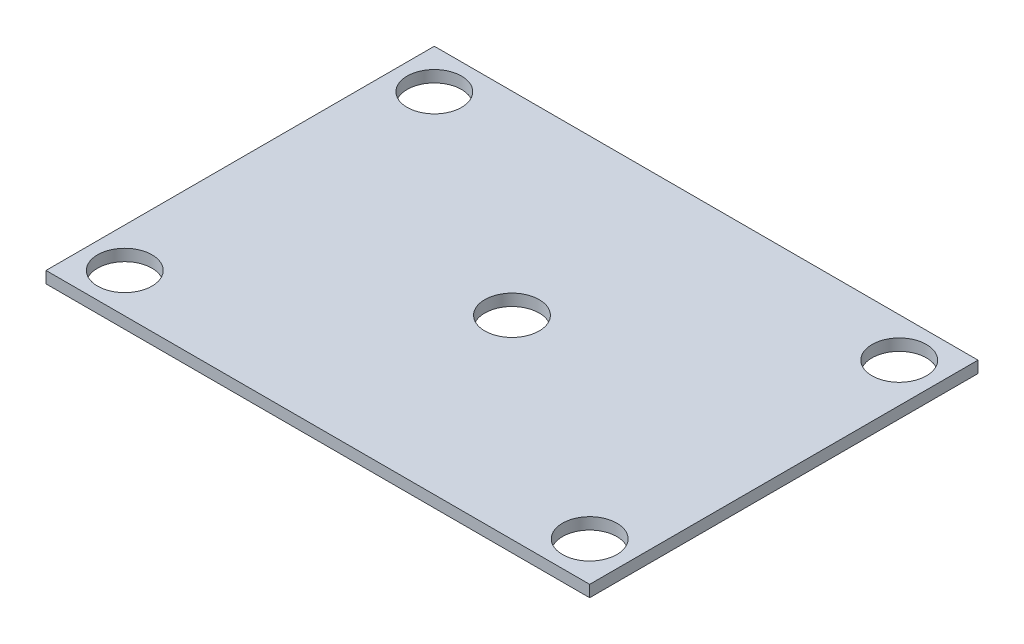
from build123d import *

# Parameters (mm, degrees)
SKETCH1_W           = 70
SKETCH1_H           = 50
BOSS_EXTRUDE1_DEPTH = 1.5
SKETCH2_R           = 3.5
CUT_EXTRUDE1_DEPTH  = 44.037774106


with BuildPart() as part:
    # Sketch1 → Boss-Extrude1 (new body)
    with BuildSketch(Plane(origin=(0, 0, 0), x_dir=(1, 0, 0), z_dir=(0, 1, 0))):
        Rectangle(SKETCH1_W, SKETCH1_H)
    extrude(amount=BOSS_EXTRUDE1_DEPTH)

    # Sketch2 → Cut-Extrude1 (cut, through all)
    with BuildSketch(Plane(origin=(0, 1.5, 0), x_dir=(1, 0, 0), z_dir=(0, 1, 0))):
        Circle(SKETCH2_R)
        with Locations((-29.928932188, 19.928932188)):
            Circle(SKETCH2_R)
        with Locations((29.928932188, 19.928932188)):
            Circle(SKETCH2_R)
        with Locations((29.928932188, -19.928932188)):
            Circle(SKETCH2_R)
        with Locations((-29.928932188, -19.928932188)):
            Circle(SKETCH2_R)
    extrude(amount=-CUT_EXTRUDE1_DEPTH, mode=Mode.SUBTRACT)


solid = part.part
